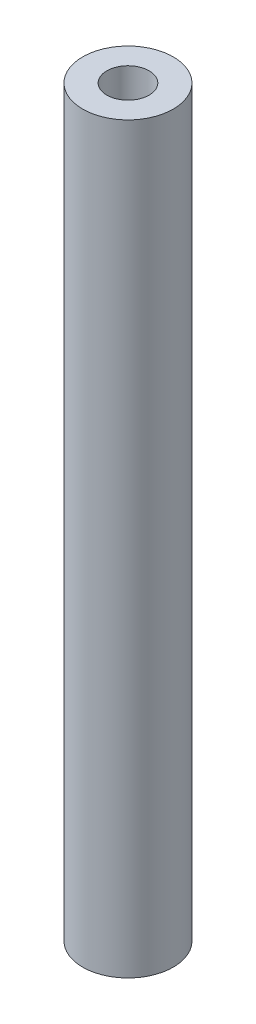
from build123d import *

# Parameters (mm, degrees)
SKETCH1_R           = 3
SKETCH1_R_2         = 1.4
BOSS_EXTRUDE1_DEPTH = 49.24


with BuildPart() as part:
    # Sketch1 → Boss-Extrude1 (new body)
    with BuildSketch(Plane(origin=(0, 0, 0), x_dir=(1, 0, 0), z_dir=(0, 1, 0))):
        Circle(SKETCH1_R)
        Circle(SKETCH1_R_2, mode=Mode.SUBTRACT)
    extrude(amount=BOSS_EXTRUDE1_DEPTH)


solid = part.part
